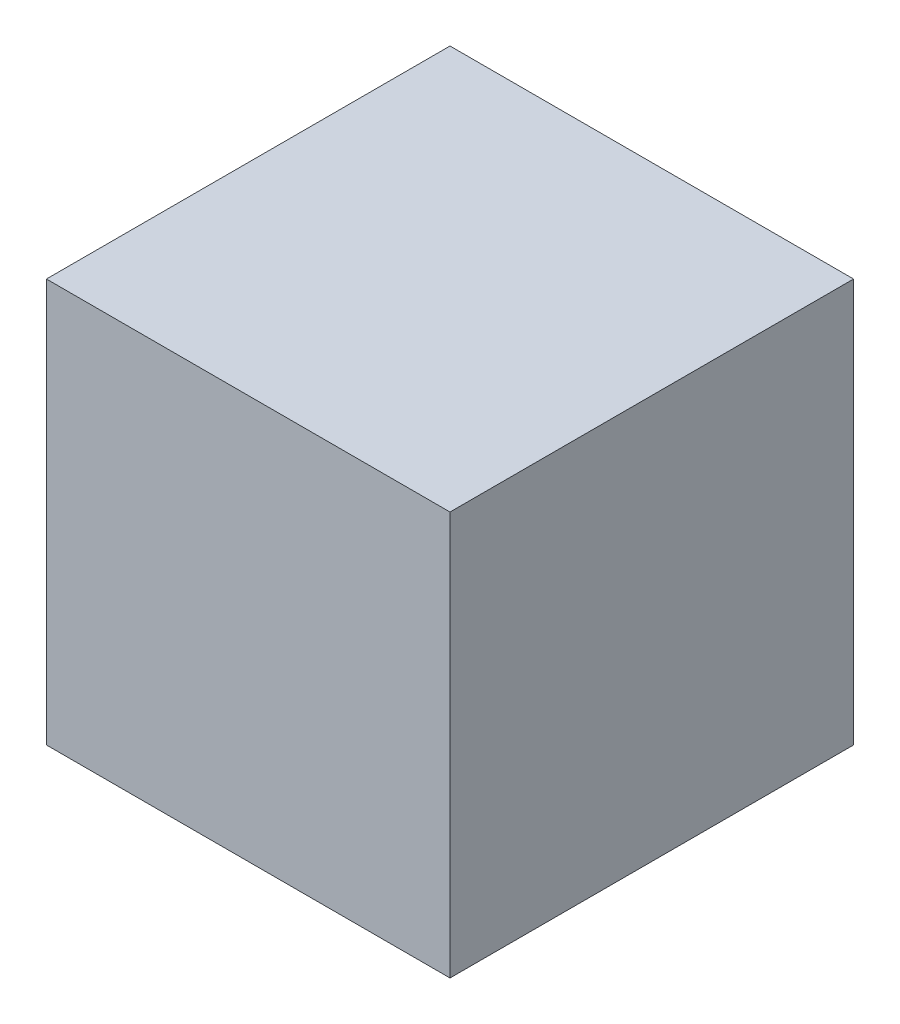
from build123d import *

# Parameters (mm, degrees)
SCHIZZO1_W                   = 94.16
SCHIZZO1_H                   = 94.16
ESTRUSIONE_ESTRUSIONE1_DEPTH = 94.16


with BuildPart() as part:
    # Schizzo1 → Estrusione-Estrusione1 (new body)
    with BuildSketch(Plane.XY):
        Rectangle(SCHIZZO1_W, SCHIZZO1_H)
    extrude(amount=ESTRUSIONE_ESTRUSIONE1_DEPTH)


solid = part.part
